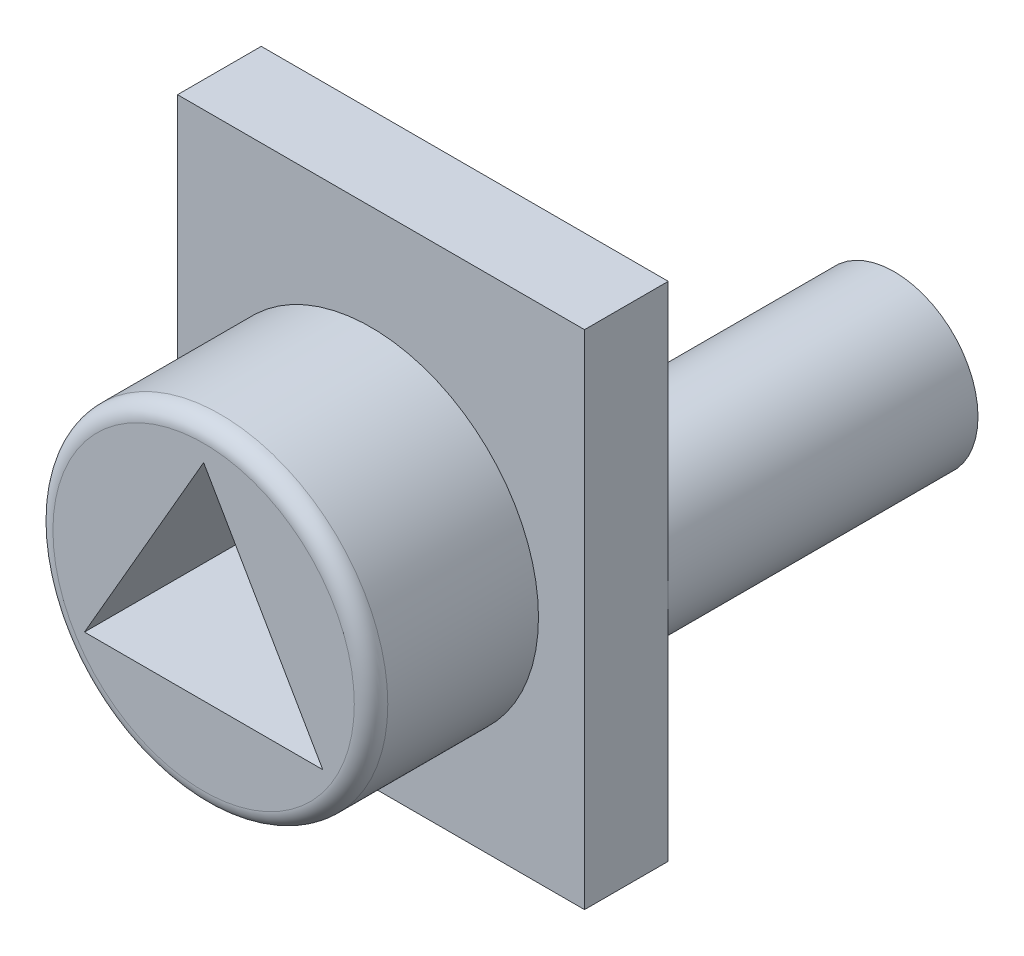
from build123d import *

# Parameters (mm, degrees)
SKETCH_2_W      = 9.723167254
SKETCH_2_H      = 12
EXTRUDE_1_DEPTH = 2
SKETCH_3_R      = 4
EXTRUDE_2_DEPTH = 4
SKETCH_4_R      = 2
EXTRUDE_3_DEPTH = 7.4
FILLET_1_R      = 0.4


with BuildPart() as part:
    # Эскиз2 → Бобышка-Вытянуть1 (new body)
    with BuildSketch(Plane.XY):
        Rectangle(SKETCH_2_W, SKETCH_2_H)
    extrude(amount=EXTRUDE_1_DEPTH)

    # Эскиз3 → Бобышка-Вытянуть2 (add)
    with BuildSketch(Plane.XY.offset(2)):
        with Locations((-0.238416373, -0.5)):
            Circle(SKETCH_3_R)
        Polygon((-3.084826535, -2.230127019), (-0.238416373, 2.7), (2.607993788, -2.230127019), align=None, mode=Mode.SUBTRACT)
    extrude(amount=EXTRUDE_2_DEPTH)

    # Эскиз4 → Бобышка-Вытянуть3 (add)
    with BuildSketch(Plane(origin=(0, 0, 0), x_dir=(-1, 0, 0), z_dir=(0, 0, -1))):
        with Locations((-2.861583627, -0.5)):
            Circle(SKETCH_4_R)
    extrude(amount=EXTRUDE_3_DEPTH)

    # Скругление1
    fillet_1_edges = [part.edges().sort_by_distance(p)[0] for p in [
        (-4.238416373, -0.5, 6),
    ]]
    fillet(fillet_1_edges, radius=FILLET_1_R)


solid = part.part
